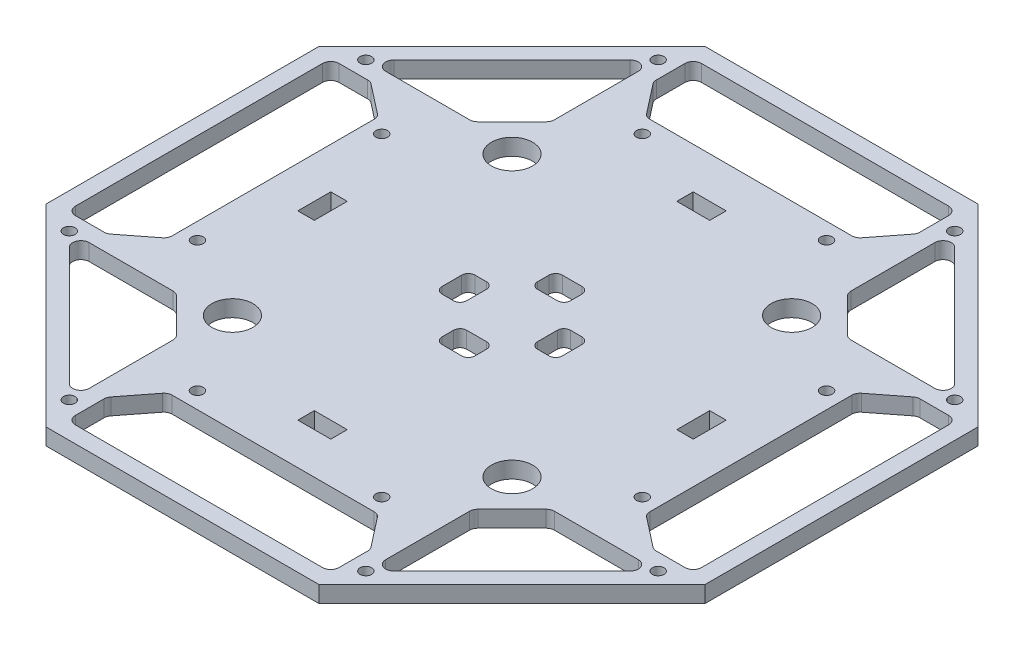
from build123d import *

# Parameters (mm, degrees)
BASE_DEPTH                   = 6.35
SUPPORT_CUTOUTS_REACH        = 181.717
SKETCH4_W                    = 12.7
SKETCH4_H                    = 6.35
SUPPORT_CUTOUT_PATTERN_COUNT = 4
F_8_CLEARANCE_HOLE1_D        = 4.4958
CABLE_HOLES_REACH            = 181.717
SKETCH14_R                   = 7.9375
LIGHTENNING_1_DEPTH          = 180.717340566
MOTOR_WIRE_HOLES_DEPTH       = 180.717340566
SKETCH30_R                   = 2.2479
NEXT_STAGE_HOLES_DEPTH       = 180.717340566
CIRPATTERN1_COUNT            = 4
LIGHTENNING_2_DEPTH          = 180.717340566
CIRPATTERN2_COUNT            = 4


with BuildPart() as part:
    # Base sketch → Base (new body)
    with BuildSketch(Plane(origin=(0, 0, 0), x_dir=(1, 0, 0), z_dir=(0, 1, 0))):
        Polygon((-127, 52.605122421), (-127, -52.605122421), (-52.605122421, -127), (52.605122421, -127), (127, -52.605122421), (127, 52.605122421), (52.605122421, 127), (-52.605122421, 127), align=None)
    extrude(amount=BASE_DEPTH)

    # Sketch4 → Support cutouts (cut, up to next)
    with BuildSketch(Plane(origin=(0, 6.35, 0), x_dir=(1, 0, 0), z_dir=(0, 1, 0)), mode=Mode.PRIVATE) as support_cutouts_sk1:
        with Locations((0, 73.025)):
            Rectangle(SKETCH4_W, SKETCH4_H)
    support_cutouts_tool1 = extrude(support_cutouts_sk1.sketch, amount=-SUPPORT_CUTOUTS_REACH, mode=Mode.PRIVATE) & part.part
    support_cutouts = support_cutouts_tool1.solids().sort_by_distance((0, 6.35, -73.025))[0]
    add(support_cutouts, mode=Mode.SUBTRACT)

    # Support cutout pattern: Support cutouts ×4 about axis
    support_cutout_pattern_axis = Axis((0, -0.29972, 0), (0, 1, 0))
    for i in range(1, SUPPORT_CUTOUT_PATTERN_COUNT):
        add(support_cutouts.rotate(support_cutout_pattern_axis, i * 360 / SUPPORT_CUTOUT_PATTERN_COUNT), mode=Mode.SUBTRACT)

    # #8 Clearance Hole1 (through all)
    with Locations(Plane(origin=(0, 6.35, 0), x_dir=(1, 0, 0), z_dir=(0, 1, 0))):
        with Locations((-85.725, 35.508457634), (-35.508457634, 85.725), (35.508457634, 85.725), (85.725, 35.508457634), (85.725, -35.508457634), (35.508457634, -85.725), (-35.508457634, -85.725), (-85.725, -35.508457634)):
            Hole(F_8_CLEARANCE_HOLE1_D / 2)

    # Sketch14 → Cable holes (cut, up to next)
    with BuildSketch(Plane(origin=(0, 6.35, 0), x_dir=(1, 0, 0), z_dir=(0, 1, 0)), mode=Mode.PRIVATE) as cable_holes_sk1:
        with Locations((-53.881536726, 53.881536726)):
            Circle(SKETCH14_R)
    cable_holes_tool1 = extrude(cable_holes_sk1.sketch, amount=-CABLE_HOLES_REACH, mode=Mode.PRIVATE) & part.part
    # Sketch14 → Cable holes (cut, up to next)
    with BuildSketch(Plane(origin=(0, 6.35, 0), x_dir=(1, 0, 0), z_dir=(0, 1, 0)), mode=Mode.PRIVATE) as cable_holes_sk2:
        with Locations((53.881536726, 53.881536726)):
            Circle(SKETCH14_R)
    cable_holes_tool2 = extrude(cable_holes_sk2.sketch, amount=-CABLE_HOLES_REACH, mode=Mode.PRIVATE) & part.part
    # Sketch14 → Cable holes (cut, up to next)
    with BuildSketch(Plane(origin=(0, 6.35, 0), x_dir=(1, 0, 0), z_dir=(0, 1, 0)), mode=Mode.PRIVATE) as cable_holes_sk3:
        with Locations((53.881536726, -53.881536726)):
            Circle(SKETCH14_R)
    cable_holes_tool3 = extrude(cable_holes_sk3.sketch, amount=-CABLE_HOLES_REACH, mode=Mode.PRIVATE) & part.part
    # Sketch14 → Cable holes (cut, up to next)
    with BuildSketch(Plane(origin=(0, 6.35, 0), x_dir=(1, 0, 0), z_dir=(0, 1, 0)), mode=Mode.PRIVATE) as cable_holes_sk4:
        with Locations((-53.881536726, -53.881536726)):
            Circle(SKETCH14_R)
    cable_holes_tool4 = extrude(cable_holes_sk4.sketch, amount=-CABLE_HOLES_REACH, mode=Mode.PRIVATE) & part.part
    add(cable_holes_tool1.solids().sort_by_distance((-53.881537, 6.35, -53.881537))[0], mode=Mode.SUBTRACT)
    add(cable_holes_tool2.solids().sort_by_distance((53.881537, 6.35, -53.881537))[0], mode=Mode.SUBTRACT)
    add(cable_holes_tool3.solids().sort_by_distance((53.881537, 6.35, 53.881537))[0], mode=Mode.SUBTRACT)
    add(cable_holes_tool4.solids().sort_by_distance((-53.881537, 6.35, 53.881537))[0], mode=Mode.SUBTRACT)

    # Sketch28 → lightenning 1 (cut, through all)
    with BuildSketch(Plane(origin=(0, 6.35, 0), x_dir=(1, 0, 0), z_dir=(0, 1, 0))):
        with BuildLine():
            Line((57.15, 73.480816204), (57.15, 105.80973824))
            ThreePointArc((57.15, 105.80973824), (59.109980102, 108.743055756), (62.57006403, 108.05480227))
            Line((62.57006403, 108.05480227), (108.05480227, 62.57006403))
            ThreePointArc((108.05480227, 62.57006403), (108.743055756, 59.109980102), (105.80973824, 57.15))
            Line((105.80973824, 57.15), (73.480816204, 57.15))
            ThreePointArc((73.480816204, 57.15), (72.265796306, 57.391682484), (71.235752174, 58.07993597))
            Line((71.235752174, 58.07993597), (58.07993597, 71.235752174))
            ThreePointArc((58.07993597, 71.235752174), (57.391682484, 72.265796306), (57.15, 73.480816204))
        make_face()
        with BuildLine():
            Line((73.480816204, -57.15), (105.80973824, -57.15))
            ThreePointArc((105.80973824, -57.15), (108.743055756, -59.109980102), (108.05480227, -62.57006403))
            Line((108.05480227, -62.57006403), (62.57006403, -108.05480227))
            ThreePointArc((62.57006403, -108.05480227), (59.109980102, -108.743055756), (57.15, -105.80973824))
            Line((57.15, -105.80973824), (57.15, -73.480816204))
            ThreePointArc((57.15, -73.480816204), (57.391682484, -72.265796306), (58.07993597, -71.235752174))
            Line((58.07993597, -71.235752174), (71.235752174, -58.07993597))
            ThreePointArc((71.235752174, -58.07993597), (72.265796306, -57.391682484), (73.480816204, -57.15))
        make_face()
        with BuildLine():
            Line((-57.15, -73.480816204), (-57.15, -105.80973824))
            ThreePointArc((-57.15, -105.80973824), (-59.109980102, -108.743055756), (-62.57006403, -108.05480227))
            Line((-62.57006403, -108.05480227), (-108.05480227, -62.57006403))
            ThreePointArc((-108.05480227, -62.57006403), (-108.743055756, -59.109980102), (-105.80973824, -57.15))
            Line((-105.80973824, -57.15), (-73.480816204, -57.15))
            ThreePointArc((-73.480816204, -57.15), (-72.265796306, -57.391682484), (-71.235752174, -58.07993597))
            Line((-71.235752174, -58.07993597), (-58.07993597, -71.235752174))
            ThreePointArc((-58.07993597, -71.235752174), (-57.391682484, -72.265796306), (-57.15, -73.480816204))
        make_face()
        with BuildLine():
            Line((-58.07993597, 71.235752174), (-71.235752174, 58.07993597))
            ThreePointArc((-71.235752174, 58.07993597), (-72.265796306, 57.391682484), (-73.480816204, 57.15))
            Line((-73.480816204, 57.15), (-105.80973824, 57.15))
            ThreePointArc((-105.80973824, 57.15), (-108.743055756, 59.109980102), (-108.05480227, 62.57006403))
            Line((-108.05480227, 62.57006403), (-62.57006403, 108.05480227))
            ThreePointArc((-62.57006403, 108.05480227), (-59.109980102, 108.743055756), (-57.15, 105.80973824))
            Line((-57.15, 105.80973824), (-57.15, 73.480816204))
            ThreePointArc((-57.15, 73.480816204), (-57.391682484, 72.265796306), (-58.07993597, 71.235752174))
        make_face()
    extrude(amount=-LIGHTENNING_1_DEPTH, mode=Mode.SUBTRACT)

    # Sketch29 → Motor wire holes (cut, through all)
    with BuildSketch(Plane(origin=(0, 6.35, 0), x_dir=(1, 0, 0), z_dir=(0, 1, 0))):
        with BuildLine():
            Line((13.6525, -3.81), (13.6525, 3.81))
            ThreePointArc((13.6525, 3.81), (14.396448776, 5.606051224), (16.1925, 6.35))
            Line((16.1925, 6.35), (20.6375, 6.35))
            ThreePointArc((20.6375, 6.35), (22.433551224, 5.606051224), (23.1775, 3.81))
            Line((23.1775, 3.81), (23.1775, -3.81))
            ThreePointArc((23.1775, -3.81), (22.433551224, -5.606051224), (20.6375, -6.35))
            Line((20.6375, -6.35), (16.1925, -6.35))
            ThreePointArc((16.1925, -6.35), (14.396448776, -5.606051224), (13.6525, -3.81))
        make_face()
        with BuildLine():
            Line((3.81, 13.6525), (-3.81, 13.6525))
            ThreePointArc((-3.81, 13.6525), (-5.606051224, 14.396448776), (-6.35, 16.1925))
            Line((-6.35, 16.1925), (-6.35, 20.6375))
            ThreePointArc((-6.35, 20.6375), (-5.606051224, 22.433551224), (-3.81, 23.1775))
            Line((-3.81, 23.1775), (3.81, 23.1775))
            ThreePointArc((3.81, 23.1775), (5.606051224, 22.433551224), (6.35, 20.6375))
            Line((6.35, 20.6375), (6.35, 16.1925))
            ThreePointArc((6.35, 16.1925), (5.606051224, 14.396448776), (3.81, 13.6525))
        make_face()
        with BuildLine():
            Line((-3.81, -13.6525), (3.81, -13.6525))
            ThreePointArc((3.81, -13.6525), (5.606051224, -14.396448776), (6.35, -16.1925))
            Line((6.35, -16.1925), (6.35, -20.6375))
            ThreePointArc((6.35, -20.6375), (5.606051224, -22.433551224), (3.81, -23.1775))
            Line((3.81, -23.1775), (-3.81, -23.1775))
            ThreePointArc((-3.81, -23.1775), (-5.606051224, -22.433551224), (-6.35, -20.6375))
            Line((-6.35, -20.6375), (-6.35, -16.1925))
            ThreePointArc((-6.35, -16.1925), (-5.606051224, -14.396448776), (-3.81, -13.6525))
        make_face()
        with BuildLine():
            Line((-13.6525, 3.81), (-13.6525, -3.81))
            ThreePointArc((-13.6525, -3.81), (-14.396448776, -5.606051224), (-16.1925, -6.35))
            Line((-16.1925, -6.35), (-20.6375, -6.35))
            ThreePointArc((-20.6375, -6.35), (-22.433551224, -5.606051224), (-23.1775, -3.81))
            Line((-23.1775, -3.81), (-23.1775, 3.81))
            ThreePointArc((-23.1775, 3.81), (-22.433551224, 5.606051224), (-20.6375, 6.35))
            Line((-20.6375, 6.35), (-16.1925, 6.35))
            ThreePointArc((-16.1925, 6.35), (-14.396448776, 5.606051224), (-13.6525, 3.81))
        make_face()
    extrude(amount=-MOTOR_WIRE_HOLES_DEPTH, mode=Mode.SUBTRACT)

    # Sketch30 → next stage holes (cut, through all)
    with BuildSketch(Plane(origin=(0, 6.35, 0), x_dir=(1, 0, 0), z_dir=(0, 1, 0))):
        with Locations((-57.15, 113.4748663)):
            Circle(SKETCH30_R)
        with Locations((57.15, 113.4748663)):
            Circle(SKETCH30_R)
    next_stage_holes = extrude(amount=-NEXT_STAGE_HOLES_DEPTH, mode=Mode.SUBTRACT)

    # CirPattern1: next stage holes ×4 about axis
    cirpattern1_axis = Axis((0, -0.29972, 0), (0, 1, 0))
    for i in range(1, CIRPATTERN1_COUNT):
        add(next_stage_holes.rotate(cirpattern1_axis, i * 360 / CIRPATTERN1_COUNT), mode=Mode.SUBTRACT)

    # Sketch31 → lightenning 2 (cut, through all)
    with BuildSketch(Plane(origin=(0, 6.35, 0), x_dir=(1, 0, 0), z_dir=(0, 1, 0))):
        with BuildLine():
            Line((-120.65, 47.625), (-120.65, -47.625))
            ThreePointArc((-120.65, -47.625), (-119.72006403, -49.87006403), (-117.475, -50.8))
            Line((-117.475, -50.8), (-106.424267714, -50.8))
            ThreePointArc((-106.424267714, -50.8), (-105.391900743, -50.627472887), (-104.471729862, -50.128641535))
            Line((-104.471729862, -50.128641535), (-93.297462148, -41.414063038))
            ThreePointArc((-93.297462148, -41.414063038), (-92.396937375, -40.303496756), (-92.075, -38.910421503))
            Line((-92.075, -38.910421503), (-92.075, 0))
            Line((-92.075, 0), (-92.075, 38.910421503))
            ThreePointArc((-92.075, 38.910421503), (-92.396937375, 40.303496756), (-93.297462148, 41.414063038))
            Line((-93.297462148, 41.414063038), (-104.471729862, 50.128641535))
            ThreePointArc((-104.471729862, 50.128641535), (-105.391900743, 50.627472887), (-106.424267714, 50.8))
            Line((-106.424267714, 50.8), (-117.475, 50.8))
            ThreePointArc((-117.475, 50.8), (-119.72006403, 49.87006403), (-120.65, 47.625))
        make_face()
    lightenning_2 = extrude(amount=-LIGHTENNING_2_DEPTH, mode=Mode.SUBTRACT)

    # CirPattern2: lightenning 2 ×4 about axis
    cirpattern2_axis = Axis((0, -0.29972, 0), (0, 1, 0))
    for i in range(1, CIRPATTERN2_COUNT):
        add(lightenning_2.rotate(cirpattern2_axis, i * 360 / CIRPATTERN2_COUNT), mode=Mode.SUBTRACT)


solid = part.part
